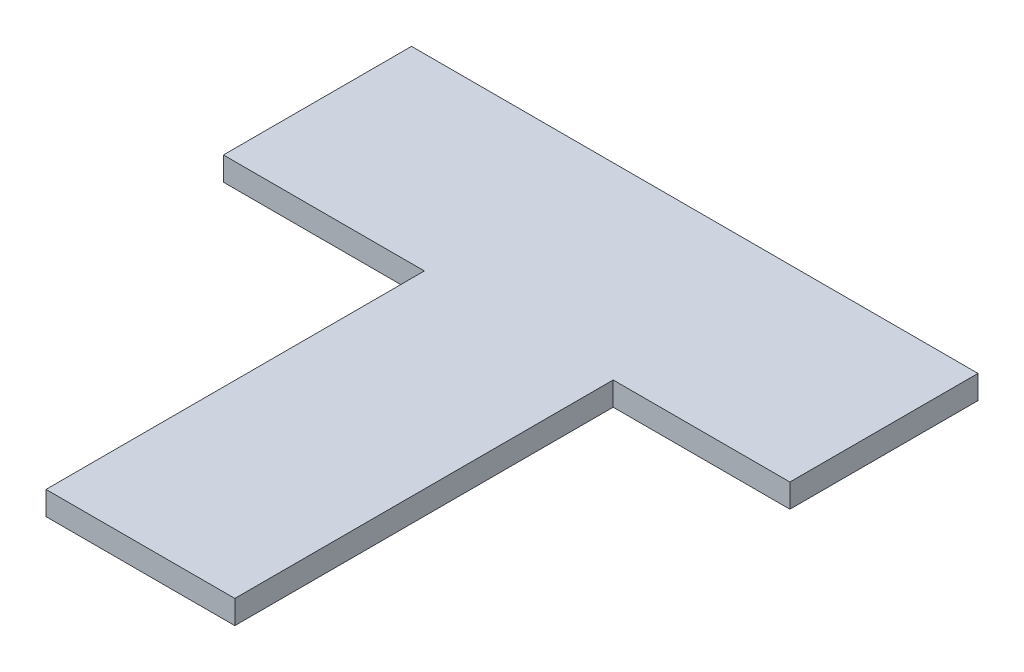
from build123d import *

# Parameters (mm, degrees)
BOSS_EXTRUDE1_DEPTH = 3.175


with BuildPart() as part:
    # Sketch1 → Boss-Extrude1 (new body)
    with BuildSketch(Plane(origin=(0, 0, 0), x_dir=(1, 0, 0), z_dir=(0, 1, 0))):
        Polygon((25.4, 50.895849057), (49.170566038, 50.895849057), (49.170566038, 76.2), (-27.029433962, 76.2), (-27.029433962, 50.895849057), (0, 50.895849057), (0, 0), (25.4, 0), align=None)
    extrude(amount=BOSS_EXTRUDE1_DEPTH)


solid = part.part
